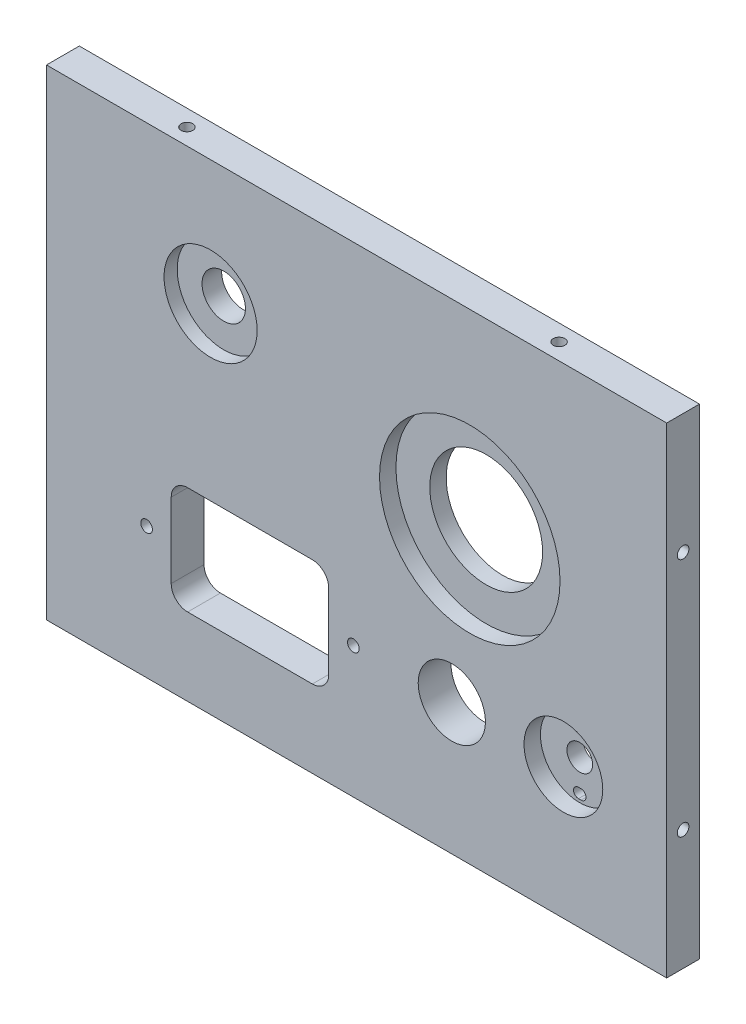
from build123d import *

# Parameters (mm, degrees)
SKETCH1_W                               = 120.00000003
SKETCH1_H                               = 92.999999928
BOSS_EXTRUDE1_DEPTH                     = 6.35
AC_INLET_DEPTH                          = 152.951711059
AC_INLET_SCREWS_D                       = 2.2606
FUSEHOLDER_D                            = 13
POWER_SWITCH_R                          = 7.62
POWER_SWITCH_INLAY_DEPTH                = 3.175
POWER_SWITCH_3_R                        = 2.4892
POWER_SWITCH_HOLE_DEPTH                 = 152.951711059
POWER_START                             = -3.175
POWER_SWITCH_LOCK_TAB_DEPTH             = 2.286
LED_PANEL_MOUNT_D                       = 8.0264
ADVANCEDHOLE1_START                     = 3.175
ADVANCEDHOLE1_OUTLINE_R                 = 17.4625
ADVANCEDHOLE1_DEPTH                     = 3.175
ADVANCEDHOLE1_2_OUTLINE_R               = 10.922
ADVANCEDHOLE1_2_DEPTH                   = 3.175
CBORE_FOR_M8_HEX_HEAD_BOLT2_D           = 8.4
CBORE_FOR_M8_HEX_HEAD_BOLT2_CBORE_D     = 18.01
CBORE_FOR_M8_HEX_HEAD_BOLT2_CBORE_DEPTH = 2.54
F_4_40_TAPPED_HOLE1_D                   = 2.2606
F_4_40_TAPPED_HOLE1_DEPTH               = 8.8646
F_4_40_TAPPED_HOLE1_TIP                 = 0.679152758
F_4_40_TAPPED_HOLE2_D                   = 2.2606
F_4_40_TAPPED_HOLE2_DEPTH               = 8.8646
F_4_40_TAPPED_HOLE2_TIP                 = 0.679152758
F_4_40_TAPPED_HOLE4_D                   = 2.2606
F_4_40_TAPPED_HOLE4_DEPTH               = 8.8646
F_4_40_TAPPED_HOLE4_TIP                 = 0.679152758


# Read off the part's stored shape, not the designer's step: AdvancedHole1, #4-40 Tapped Hole3
with BuildPart() as part:
    # Sketch1 → Boss-Extrude1 (new body)
    with BuildSketch(Plane.XY):
        with Locations((60.000000015, 46.499999964)):
            Rectangle(SKETCH1_W, SKETCH1_H)
    extrude(amount=BOSS_EXTRUDE1_DEPTH)

    # Sketch6 → AC Inlet (cut, through all)
    with BuildSketch(Plane(origin=(0, 0, 0), x_dir=(-1, 0, 0), z_dir=(0, 0, -1))):
        with BuildLine():
            Line((-51.435, 35.814), (-27.305, 35.814))
            ThreePointArc((-27.305, 35.814), (-25.05993597, 34.88406403), (-24.13, 32.639))
            Line((-24.13, 32.639), (-24.13, 18.161))
            ThreePointArc((-24.13, 18.161), (-25.05993597, 15.91593597), (-27.305, 14.986))
            Line((-27.305, 14.986), (-51.435, 14.986))
            ThreePointArc((-51.435, 14.986), (-53.68006403, 15.91593597), (-54.61, 18.161))
            Line((-54.61, 18.161), (-54.61, 32.639))
            ThreePointArc((-54.61, 32.639), (-53.68006403, 34.88406403), (-51.435, 35.814))
        make_face()
    extrude(amount=-AC_INLET_DEPTH, mode=Mode.SUBTRACT)

    # AC Inlet Screws (through all)
    with Locations(Plane(origin=(0, 0, 0), x_dir=(-1, 0, 0), z_dir=(0, 0, -1))):
        with Locations((-59.3725, 25.4), (-19.3675, 25.4)):
            Hole(AC_INLET_SCREWS_D / 2)

    # Fuseholder (through all)
    with Locations(Plane(origin=(0, 0, 0), x_dir=(-1, 0, 0), z_dir=(0, 0, -1))):
        with Locations((-78.4225, 25.4)):
            Hole(FUSEHOLDER_D / 2)

    # Power Switch → Power Switch Inlay (cut)
    with BuildSketch(Plane.XY.offset(6.35)):
        with Locations((100.0125, 25.4)):
            Circle(POWER_SWITCH_R)
    extrude(amount=-POWER_SWITCH_INLAY_DEPTH, mode=Mode.SUBTRACT)

    # Power Switch<3> → Power Switch Hole (cut, through all)
    with BuildSketch(Plane.XY.offset(6.35)):
        with Locations((100.0125, 25.4)):
            Circle(POWER_SWITCH_3_R)
    extrude(amount=-POWER_SWITCH_HOLE_DEPTH, mode=Mode.SUBTRACT)

    # Power Switch<4> → Power Switch Lock Tab (cut)
    with BuildSketch(Plane.XY.offset(6.35).offset(POWER_START)):
        with BuildLine():
            Line((99.7585, 20.2525), (100.2665, 20.2525))
            ThreePointArc((100.2665, 20.2525), (101.219, 19.3), (100.2665, 18.3475))
            Line((100.2665, 18.3475), (99.7585, 18.3475))
            ThreePointArc((99.7585, 18.3475), (98.806, 19.3), (99.7585, 20.2525))
        make_face()
    extrude(amount=-POWER_SWITCH_LOCK_TAB_DEPTH, mode=Mode.SUBTRACT)

    # LED Panel Mount (through all)
    with Locations(Plane(origin=(0, 0, 0), x_dir=(-1, 0, 0), z_dir=(0, 0, -1))):
        with Locations((-31.75, 68.869999928)):
            Hole(LED_PANEL_MOUNT_D / 2)

    # AdvancedHole1 outline → AdvancedHole1 (cut)
    with BuildSketch(Plane.XY.offset(ADVANCEDHOLE1_START)):
        with Locations((81.90000003, 56.169999928)):
            Circle(ADVANCEDHOLE1_OUTLINE_R)
    extrude(amount=ADVANCEDHOLE1_DEPTH, mode=Mode.SUBTRACT)

    # AdvancedHole1 2 outline → AdvancedHole1 2 (cut)
    with BuildSketch(Plane.XY):
        with Locations((81.90000003, 56.169999928)):
            Circle(ADVANCEDHOLE1_2_OUTLINE_R)
    extrude(amount=ADVANCEDHOLE1_2_DEPTH, mode=Mode.SUBTRACT)

    # CBORE for M8 Hex Head Bolt2 (through all)
    with Locations(Plane.XY.offset(6.35)):
        with Locations((31.75, 68.869999928)):
            CounterBoreHole(CBORE_FOR_M8_HEX_HEAD_BOLT2_D / 2, CBORE_FOR_M8_HEX_HEAD_BOLT2_CBORE_D / 2, CBORE_FOR_M8_HEX_HEAD_BOLT2_CBORE_DEPTH)

    # #4-40 Tapped Hole1
    with Locations(Plane(origin=(0, 0, 0), x_dir=(-1, 0, 0), z_dir=(0, -1, 0))):
        with Locations((-24.000000006, -3.175), (-96.000000024, -3.175)):
            Hole(F_4_40_TAPPED_HOLE1_D / 2, depth=F_4_40_TAPPED_HOLE1_DEPTH)
            with Locations((0, 0, -(F_4_40_TAPPED_HOLE1_DEPTH + F_4_40_TAPPED_HOLE1_TIP / 2))):  # 118° drill point
                Cone(0, F_4_40_TAPPED_HOLE1_D / 2, F_4_40_TAPPED_HOLE1_TIP, mode=Mode.SUBTRACT)

    # #4-40 Tapped Hole2
    with Locations(Plane(origin=(0, 92.999999928, 0), x_dir=(1, 0, 0), z_dir=(0, 1, 0))):
        with Locations((24.000000006, -3.175), (96.000000024, -3.175)):
            Hole(F_4_40_TAPPED_HOLE2_D / 2, depth=F_4_40_TAPPED_HOLE2_DEPTH)
            with Locations((0, 0, -(F_4_40_TAPPED_HOLE2_DEPTH + F_4_40_TAPPED_HOLE2_TIP / 2))):  # 118° drill point
                Cone(0, F_4_40_TAPPED_HOLE2_D / 2, F_4_40_TAPPED_HOLE2_TIP, mode=Mode.SUBTRACT)

    # #4-40 Tapped Hole3 outline → #4-40 Tapped Hole3 (revolve, cut)
    with BuildSketch(Plane(origin=(0, 23.249999982, 3.175), x_dir=(0, 1, 0), z_dir=(0, 0, -1))):
        Polygon((1.1303, 8.8646), (0, 9.543752758), (0, 0), (1.1303, 0), align=None)
    revolve(axis=Axis((0, 23.249999982, 3.175), (1, 0, 0)), mode=Mode.SUBTRACT)

    # 4-40 Tapped Hole3 2 outline → 4-40 Tapped Hole3 2 (revolve, cut)
    with BuildSketch(Plane(origin=(0, 69.749999946, 3.175), x_dir=(0, 1, 0), z_dir=(0, 0, -1))):
        Polygon((1.1303, 8.8646), (0, 9.543752758), (0, 0), (1.1303, 0), align=None)
    revolve(axis=Axis((0, 69.749999946, 3.175), (1, 0, 0)), mode=Mode.SUBTRACT)

    # #4-40 Tapped Hole4
    with Locations(Plane(origin=(120.00000003, 0, 0), x_dir=(0, 0, -1), z_dir=(1, 0, 0))):
        with Locations((-3.175, 69.749999946), (-3.175, 23.249999982)):
            Hole(F_4_40_TAPPED_HOLE4_D / 2, depth=F_4_40_TAPPED_HOLE4_DEPTH)
            with Locations((0, 0, -(F_4_40_TAPPED_HOLE4_DEPTH + F_4_40_TAPPED_HOLE4_TIP / 2))):  # 118° drill point
                Cone(0, F_4_40_TAPPED_HOLE4_D / 2, F_4_40_TAPPED_HOLE4_TIP, mode=Mode.SUBTRACT)


solid = part.part
